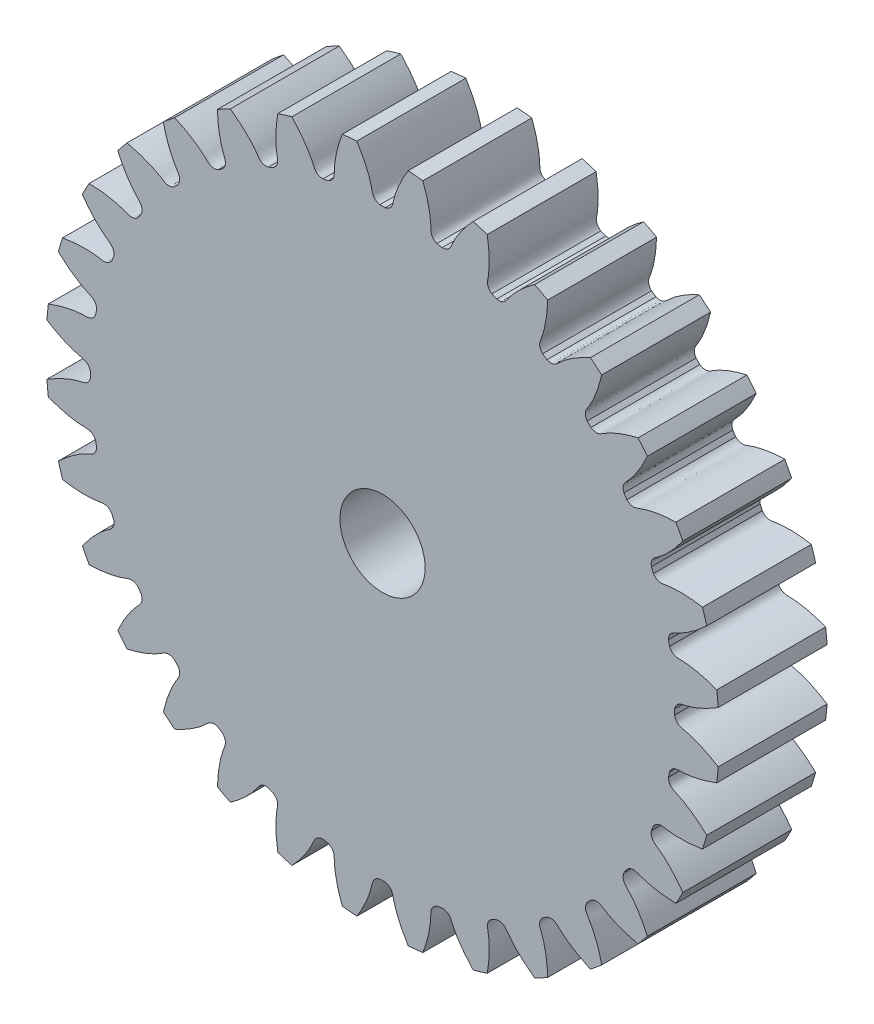
from build123d import *

# Parameters (mm, degrees)
SKETCH_1_R               = 8.5
EXTRUDE_1_DEPTH          = 2.75
CUT_EXTRUDE_1_DEPTH      = 13.331362455
PATTERN_CIRCULAR_1_COUNT = 32
CUT_EXTRUDE_2_REACH      = 14.297
SKETCH_4_R               = 1.075


with BuildPart() as part:
    # 草图1 → 凸台-拉伸1 (new body)
    with BuildSketch(Plane.XY):
        Circle(SKETCH_1_R)
    extrude(amount=EXTRUDE_1_DEPTH)

    # 草图2 → 切除-拉伸1 (cut, through all)
    with BuildSketch(Plane.XY):
        with BuildLine():
            ThreePointArc((0.067016057, 7.374695509), (0, 7.375), (-0.067016057, 7.374695509))
            add(Edge.make_bspline(
                [(-0.067016057, 7.374695509), (-0.244409752, 7.417585205), (-0.254185421, 7.546206625), (-0.286714327, 7.680381026), (-0.295183058, 7.71268082), (-0.305128683, 7.747692877), (-0.31664673, 7.785376713), (-0.32985255, 7.825680217), (-0.344853694, 7.868550436), (-0.361758143, 7.913930361), (-0.380671731, 7.961759942), (-0.401698795, 8.011975833), (-0.424941869, 8.064511528), (-0.450501667, 8.119297378), (-0.478476978, 8.176260642), (-0.508964584, 8.235325541), (-0.542059185, 8.296413305), (-0.577853311, 8.359442229), (-0.616437247, 8.424327727), (-0.657898954, 8.490982392), (-0.702323991, 8.559316051), (-0.749795443, 8.629235832), (-0.800393843, 8.700646224), (-0.854197106, 8.773449143), (-0.911280452, 8.847543999), (-0.971716342, 8.922827763), (-1.035574408, 8.999195043), (-1.102921392, 9.07653815), (-1.173821075, 9.154747175), (-1.248334222, 9.233710065), (-1.326518523, 9.313312698), (-1.40842851, 9.393438964), (-1.524138832, 9.502187768), (-1.614498649, 9.582084996), (-1.676516268, 9.63480345)],
                knots=[0, 0, 0, 0, 0.124532679, 0.135328735, 0.147193327, 0.160126453, 0.174128116, 0.189198313, 0.205337046, 0.222544314, 0.240820117, 0.260164456, 0.28057733, 0.302058739, 0.324608684, 0.348227164, 0.372914179, 0.39866973, 0.425493816, 0.453386438, 0.482347595, 0.512377287, 0.543475514, 0.575642277, 0.608877575, 0.643181408, 0.678553777, 0.714994681, 0.752504121, 0.791082096, 0.830728606, 0.871443651, 0.913227232, 1, 1, 1, 1], degree=3))
            ThreePointArc((-1.676516268, 9.63480345), (0, 9.779577922), (1.676516268, 9.63480345))
            add(Edge.make_bspline(
                [(0.067016057, 7.374695509), (0.244409752, 7.417585205), (0.254185421, 7.546206625), (0.286714327, 7.680381026), (0.295183058, 7.71268082), (0.305128683, 7.747692877), (0.31664673, 7.785376713), (0.32985255, 7.825680217), (0.344853694, 7.868550436), (0.361758143, 7.913930361), (0.380671731, 7.961759942), (0.401698795, 8.011975833), (0.424941869, 8.064511528), (0.450501667, 8.119297378), (0.478476978, 8.176260642), (0.508964584, 8.235325541), (0.542059185, 8.296413305), (0.577853311, 8.359442229), (0.616437247, 8.424327727), (0.657898954, 8.490982392), (0.702323991, 8.559316051), (0.749795443, 8.629235832), (0.800393843, 8.700646224), (0.854197106, 8.773449143), (0.911280452, 8.847543999), (0.971716342, 8.922827763), (1.035574408, 8.999195043), (1.102921392, 9.07653815), (1.173821075, 9.154747175), (1.248334222, 9.233710065), (1.326518523, 9.313312698), (1.40842851, 9.393438964), (1.524138832, 9.502187768), (1.614498649, 9.582084996), (1.676516268, 9.63480345)],
                knots=[0, 0, 0, 0, 0.124532679, 0.135328735, 0.147193327, 0.160126453, 0.174128116, 0.189198313, 0.205337046, 0.222544314, 0.240820117, 0.260164456, 0.28057733, 0.302058739, 0.324608684, 0.348227164, 0.372914179, 0.39866973, 0.425493816, 0.453386438, 0.482347595, 0.512377287, 0.543475514, 0.575642277, 0.608877575, 0.643181408, 0.678553777, 0.714994681, 0.752504121, 0.791082096, 0.830728606, 0.871443651, 0.913227232, 1, 1, 1, 1], degree=3))
        make_face()
    cut_extrude_1 = extrude(amount=CUT_EXTRUDE_1_DEPTH, mode=Mode.SUBTRACT)

    # 阵列(圆周)1: 切除-拉伸1 ×32 about axis
    pattern_circular_1_axis = Axis((0, 0, 2.75), (0, 0, -1))
    for i in range(1, PATTERN_CIRCULAR_1_COUNT):
        add(cut_extrude_1.rotate(pattern_circular_1_axis, i * 360 / PATTERN_CIRCULAR_1_COUNT), mode=Mode.SUBTRACT)

    # 草图4 → 切除-拉伸2 (cut, up to next)
    with BuildSketch(Plane(origin=(0, 0, 0), x_dir=(-1, 0, 0), z_dir=(0, 0, -1)), mode=Mode.PRIVATE) as cut_extrude_2_sk1:
        Circle(SKETCH_4_R)
    cut_extrude_2_tool1 = extrude(cut_extrude_2_sk1.sketch, amount=-CUT_EXTRUDE_2_REACH, mode=Mode.PRIVATE) & part.part
    add(cut_extrude_2_tool1.solids().sort_by_distance((0, 0, 0))[0], mode=Mode.SUBTRACT)


solid = part.part
